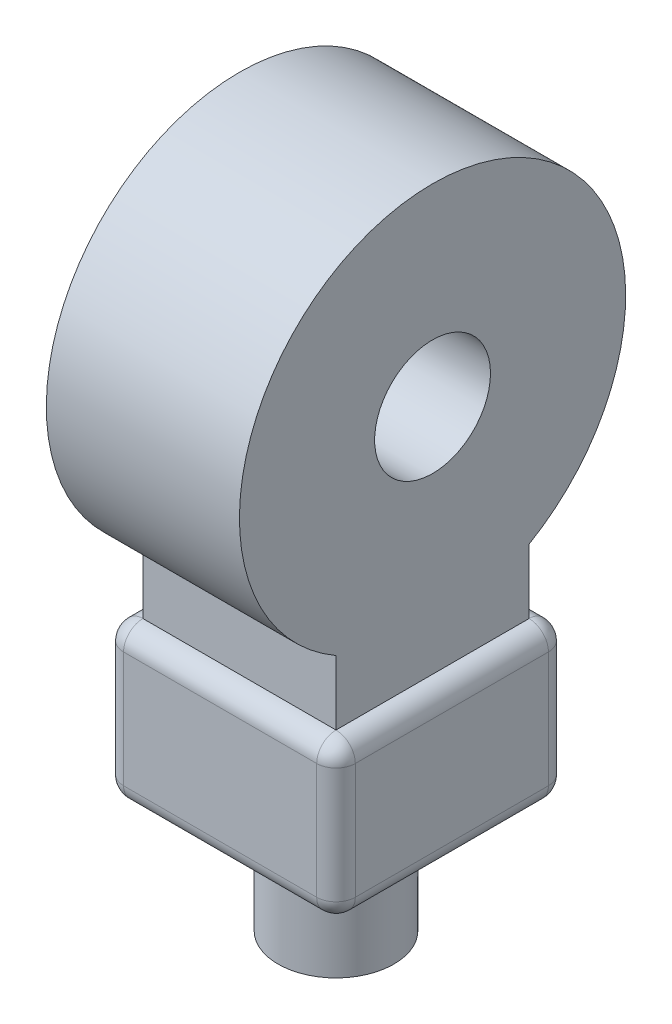
from build123d import *

# Parameters (mm, degrees)
SKETCH_1_W      = 60
SKETCH_1_H      = 60
EXTRUDE_1_DEPTH = 40
SKETCH_2_R      = 15
EXTRUDE_2_DEPTH = 30
SKETCH_3_R      = 15
EXTRUDE_3_DEPTH = 25
FILLET_11_R     = 5


with BuildPart() as part:
    # 草圖1 → 填料-伸長1 (new body)
    with BuildSketch(Plane(origin=(0, 0, 0), x_dir=(1, 0, 0), z_dir=(0, 1, 0))):
        Rectangle(SKETCH_1_W, SKETCH_1_H)
    extrude(amount=EXTRUDE_1_DEPTH)

    # 草圖2 → 填料-伸長2 (add)
    with BuildSketch(Plane.XZ):
        with Locations(Location((0, 0, 0), (0, 0, 270))):
            Circle(SKETCH_2_R)
    extrude(amount=EXTRUDE_2_DEPTH)

    # 草圖3 → 填料-伸長3 (add, symmetric)
    with BuildSketch(Plane(origin=(0, 0, 0), x_dir=(0, 0, -1), z_dir=(1, 0, 0))):
        with BuildLine():
            Line((-25, 40), (25, 40))
            Line((25, 40), (25, 56.698729811))
            ThreePointArc((25, 56.698729811), (0, 150), (-25, 56.698729811))
            Line((-25, 56.698729811), (-25, 40))
        make_face()
        with Locations((0, 100)):
            Circle(SKETCH_3_R, mode=Mode.SUBTRACT)
    extrude(amount=EXTRUDE_3_DEPTH, both=True)

    # 圓角11
    fillet_11_edges = [part.edges().sort_by_distance(p)[0] for p in [
        (-30, 40, 0),
        (0, 40, 30),
        (30, 40, 0),
        (0, 0, 30),
        (-30, 0, 0),
        (0, 0, -30),
        (30, 0, 0),
        (0, 40, -30),
        (30, 20, 30),
        (-30, 20, 30),
        (-30, 20, -30),
        (30, 20, -30),
    ]]
    fillet(fillet_11_edges, radius=FILLET_11_R - 0.0001)  # a hair under: the kernel refuses the full size


solid = part.part
